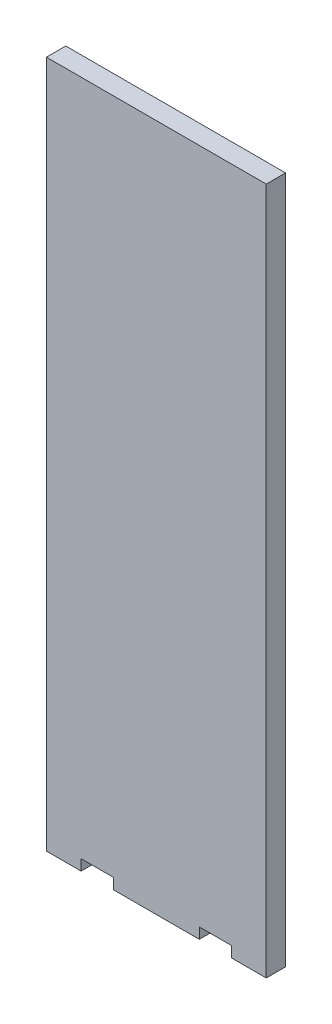
from build123d import *

# Parameters (mm, degrees)
SKETCH1_W                    = 204.6
SKETCH1_H                    = 640
BOSS_EXTRUDE1_DEPTH          = 18
F_3_0_3_DIAMETER_HOLE1_D     = 3
F_3_0_3_DIAMETER_HOLE1_DEPTH = 5
F_3_0_3_DIAMETER_HOLE1_TIP   = 0.901290929
SKETCH4_W                    = 30
SKETCH4_H                    = 10
CUT_EXTRUDE1_DEPTH           = 18


with BuildPart() as part:
    # Sketch1 → Boss-Extrude1 (new body)
    with BuildSketch(Plane.XY):
        with Locations((97, 283.5)):
            Rectangle(SKETCH1_W, SKETCH1_H)
    extrude(amount=BOSS_EXTRUDE1_DEPTH)

    # Ø3.0 (3) Diameter Hole1
    with Locations(Plane(origin=(0, 0, 0), x_dir=(-1, 0, 0), z_dir=(0, 0, -1))):
        with Locations((-61.027798534, -30.583242825), (-20.2, 478.5), (-173.8, 478.5), (-173.8, 190.5), (-20.2, 190.5), (-20.2, -1.5), (-173.8, -1.5), (-131.94764624, 597.773192668), (-61.027798534, 597.773192668), (-131.94764624, -30.583242825)):
            Hole(F_3_0_3_DIAMETER_HOLE1_D / 2, depth=F_3_0_3_DIAMETER_HOLE1_DEPTH)
            with Locations((0, 0, -(F_3_0_3_DIAMETER_HOLE1_DEPTH + F_3_0_3_DIAMETER_HOLE1_TIP / 2))):  # 118° drill point
                Cone(0, F_3_0_3_DIAMETER_HOLE1_D / 2, F_3_0_3_DIAMETER_HOLE1_TIP, mode=Mode.SUBTRACT)

    # Sketch4 → Cut-Extrude1 (cut)
    with BuildSketch(Plane(origin=(0, 0, 0), x_dir=(-1, 0, 0), z_dir=(0, 0, -1))):
        with Locations((-42, -31.5)):
            Rectangle(SKETCH4_W, SKETCH4_H)
        with Locations((-152, -31.5)):
            Rectangle(SKETCH4_W, SKETCH4_H)
    extrude(amount=-CUT_EXTRUDE1_DEPTH, mode=Mode.SUBTRACT)


solid = part.part
